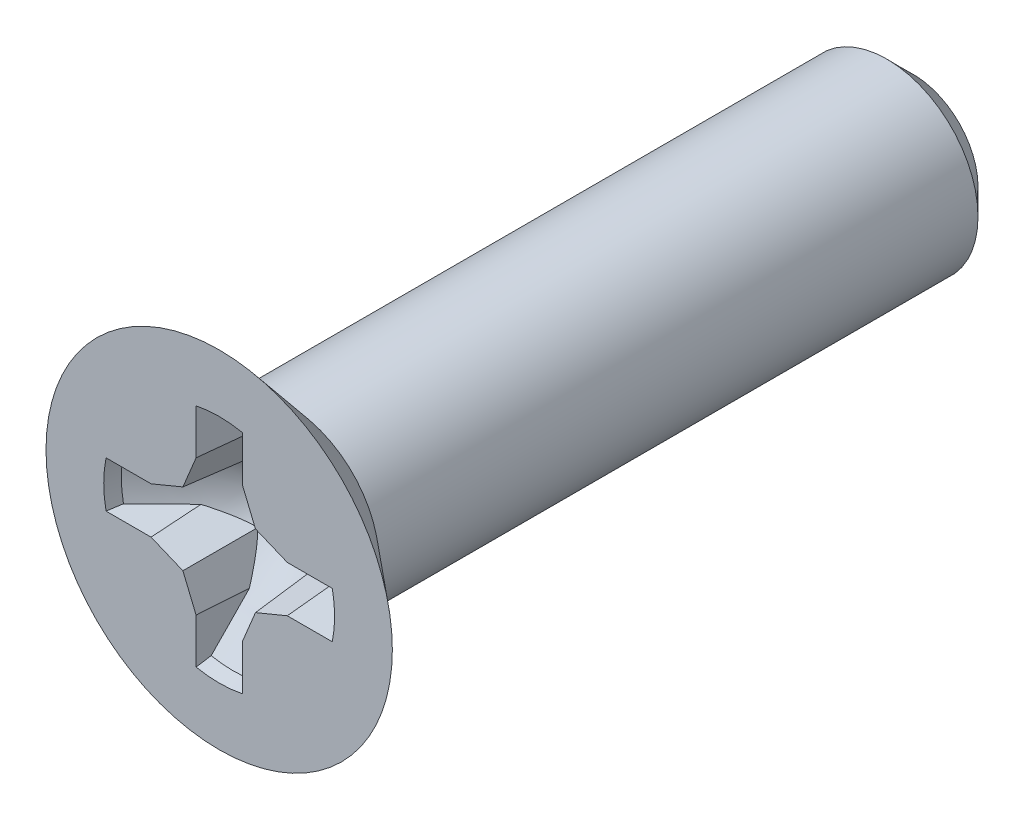
from build123d import *

# Parameters (mm, degrees)
SKETCH1_R          = 3.9624
EXTRUDE3_DEPTH     = 1.8288
SKETCH4_W          = 15.875
SKETCH4_H          = 2.0828
CHAMFER1_SIZE      = 0.5953125
SKETCH26_R         = 1.0414
EXTRUDE8_DEPTH     = 1.8288
CUT_EXTRUDE3_REACH = 18.835
CIRPATTERN1_COUNT  = 4
DRAFT2_ANGLE       = 5


# Read off the part's stored shape, not the designer's step: Extrude10, Draft1
with BuildPart() as part:
    # Sketch1 → Extrude3 (new body)
    with BuildSketch(Plane.XY):
        Circle(SKETCH1_R)
    extrude(amount=EXTRUDE3_DEPTH)

    # Sketch11 → Cut-Revolve3 (revolve, cut)
    with BuildSketch(Plane(origin=(0, 0, 0), x_dir=(0, 0, -1), z_dir=(1, 0, 0)), mode=Mode.PRIVATE) as cut_revolve3_sk:
        Polygon((0, 1.78292103), (-1.8288, 3.9624), (0, 3.9624), align=None)
    revolve(cut_revolve3_sk.sketch.rotate(Axis((0, 0, -0.441444004), (0, 0, 1)), 90), axis=Axis((0, 0, -0.441444004), (0, 0, 1)), mode=Mode.SUBTRACT)

    # Extrude10 outline → Extrude10 (revolve)
    with BuildSketch(Plane.XZ):
        Polygon((2.0828, 0), (2.0828, 0.251628333), (1.78292103, 0.251628333), (1.78292103, 0), (0, 0), (0, -2.0828), align=None)
    revolve(axis=Axis((0, 0, 0), (0, 0, 1)))



with BuildPart() as body_2:
    # Sketch4 → Revolve1 (revolve)
    with BuildSketch(Plane(origin=(0, 0, 0), x_dir=(0, 0, -1), z_dir=(1, 0, 0)), mode=Mode.PRIVATE) as revolve1_sk:
        with Locations((6.1087, 1.0414)):
            Rectangle(SKETCH4_W, SKETCH4_H)
    revolve(revolve1_sk.sketch.rotate(Axis((0, 0, 1.8288), (0, 0, -1)), 180), axis=Axis((0, 0, 1.8288), (0, 0, -1)))

    # Chamfer1
    chamfer1_edges = [body_2.edges().sort_by_distance(p)[0] for p in [
        (0, 2.0828, -14.0462),
    ]]
    chamfer(chamfer1_edges, length=CHAMFER1_SIZE)


with BuildPart() as part_1:
    add(part.part)

    add(body_2.part)  # Extrude8 merges body 2
    # Sketch26 → Extrude8 (add)
    with BuildSketch(Plane.XY.offset(1.8288)):
        Circle(SKETCH26_R)
    extrude(amount=-EXTRUDE8_DEPTH)

    # Cut-Extrude3: up to this cone (the profile starts inside it)
    cut_extrude3_end = Plane(origin=(0, 0, 1.8288), z_dir=(0, 0, 1)).offset(-2.462756405) * Cone(1.192e-06, 29.475352474, 24.732756389, align=(Align.CENTER, Align.CENTER, Align.MIN), mode=Mode.PRIVATE)
    # Sketch12 → Cut-Extrude3 (cut, up to the surface)
    with BuildSketch(Plane.XY.offset(1.8288), mode=Mode.PRIVATE) as cut_extrude3_sk1:
        with BuildLine():
            Line((2.588228842, 0.52832), (1.558274421, 0.52832))
            Line((1.558274421, 0.52832), (0.829986666, 0.829986666))
            Line((0.829986666, 0.829986666), (0.52832, 1.558274421))
            Line((0.52832, 1.558274421), (0.52832, 2.588228842))
            ThreePointArc((0.52832, 2.588228842), (0.265504474, 2.628223342), (0, 2.6416))
            Line((0, 2.6416), (0, 0))
            Line((0, 0), (2.6416, 0))
            ThreePointArc((2.6416, 0), (2.628223342, 0.265504474), (2.588228842, 0.52832))
        make_face()
    cut_extrude3_tool1 = extrude(cut_extrude3_sk1.sketch, amount=-CUT_EXTRUDE3_REACH, mode=Mode.PRIVATE) & cut_extrude3_end
    cut_extrude3 = cut_extrude3_tool1.solids().sort_by_distance((2.591055, 0.26175, 1.8288))[0]
    add(cut_extrude3, mode=Mode.SUBTRACT)

    # CirPattern1: Cut-Extrude3 ×4 about axis
    cirpattern1_axis = Axis((0, 0, 0), (0, 0, 1))
    for i in range(1, CIRPATTERN1_COUNT):
        add(cut_extrude3.rotate(cirpattern1_axis, i * 360 / CIRPATTERN1_COUNT), mode=Mode.SUBTRACT)

    # Draft1 outline → Draft1 (revolve)
    with BuildSketch(Plane.XZ):
        Polygon((2.6416, 1.8288), (2.556499421, 1.511200317), (2.6416, 1.511200317), align=None)
    revolve(axis=Axis((0, 0, 0), (0, 0, 1)))

    # Draft2
    draft2_faces = [part_1.faces().sort_by_distance(p)[0] for p in [
        (0.52832, 1.956108767, 1.448849015),
        (0.686884975, 1.175464708, 1.173602986),
        (1.175464708, 0.686884975, 1.173602986),
        (1.956108767, 0.52832, 1.448849015),
        (1.956108767, -0.52832, 1.448849015),
        (1.175464708, -0.686884975, 1.173602986),
        (0.686884975, -1.175464708, 1.173602986),
        (0.52832, -1.956108767, 1.448849015),
        (-0.52832, -1.956108767, 1.448849015),
        (-0.686884975, -1.175464708, 1.173602986),
        (-1.175464708, -0.686884975, 1.173602986),
        (-1.956108767, -0.52832, 1.448849015),
        (-1.956108767, 0.52832, 1.448849015),
        (-1.175464708, 0.686884975, 1.173602986),
        (-0.686884975, 1.175464708, 1.173602986),
        (-0.52832, 1.956108767, 1.448849015),
    ]]
    draft(draft2_faces, Plane(origin=(0, 2.0828, 1.8288), x_dir=(0, 1, 0), z_dir=(0, 0, 1)), DRAFT2_ANGLE)


solid = part_1.part
